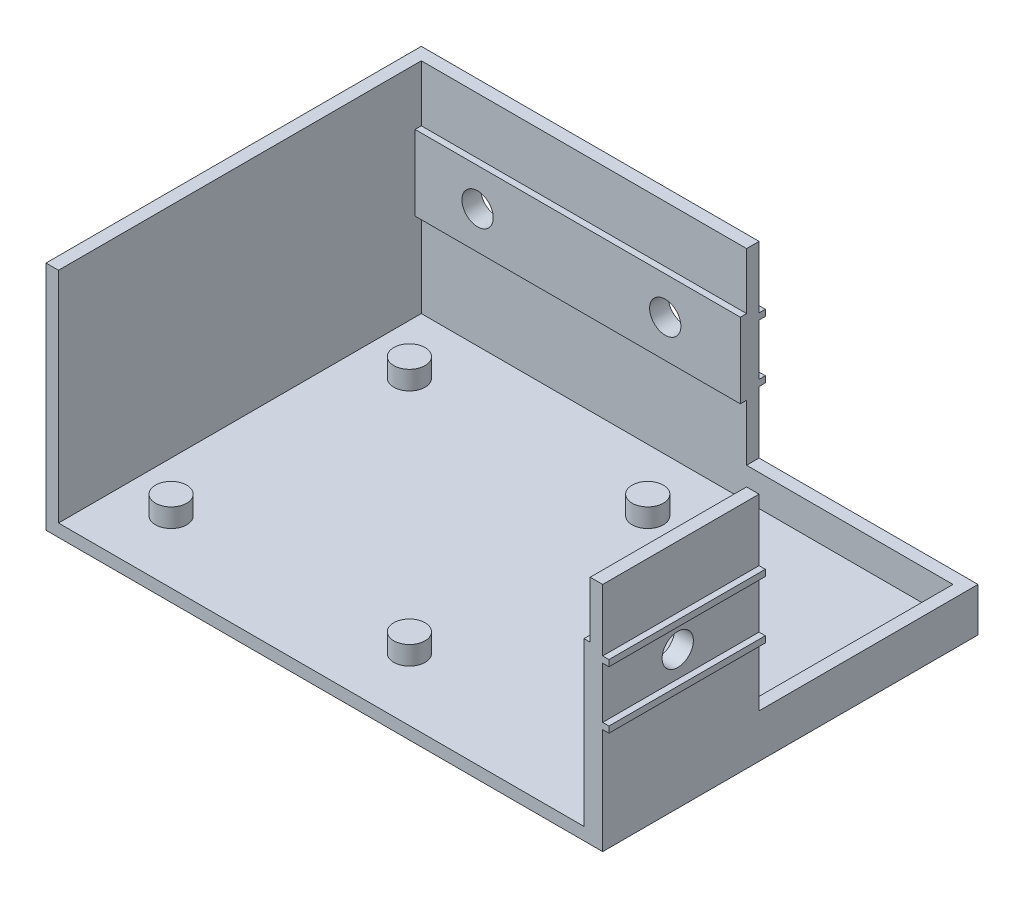
from build123d import *

# Parameters (mm, degrees)
SKETCH_382_W           = 89
SKETCH_382_H           = 60
EXTRUDE_435_DEPTH      = 2
SKETCH_485_R           = 2.5
EXTRUDE_742_DEPTH      = 3
EXTRUDE_971_DEPTH      = 35
SKETCH_4_W             = 35
SKETCH_4_H             = 35
CUT_EXTRUDE_1209_DEPTH = 30
SKETCH_8_W             = 25
SKETCH_8_H             = 26
EXTRUDE_1460_DEPTH     = 1
SKETCH_10_R            = 2.5
CUT_EXTRUDE_1690_DEPTH = 112.198021565
SKETCH_11_W            = 25
SKETCH_11_H            = 1
EXTRUDE_2041_DEPTH     = 1
SKETCH_7_W             = 52
SKETCH_7_H             = 12
EXTRUDE_2256_DEPTH     = 1
SKETCH_2308_R          = 2.5
CUT_EXTRUDE_2474_DEPTH = 113.774110504
SKETCH_12_W            = 54
SKETCH_12_H            = 1
EXTRUDE_2720_DEPTH     = 1


with BuildPart() as part:
    # Sketch 382 → Extrude 435 (new body)
    with BuildSketch(Plane(origin=(0, 0, 0), x_dir=(1, 0, 0), z_dir=(0, 1, 0))):
        with Locations((44.5, 30)):
            Rectangle(SKETCH_382_W, SKETCH_382_H)
    extrude(amount=EXTRUDE_435_DEPTH)

    # Sketch 485 → Extrude 742 (add)
    with BuildSketch(Plane(origin=(0, 2, 0), x_dir=(1, 0, 0), z_dir=(0, 1, 0))):
        with Locations((10, 10)):
            Circle(SKETCH_485_R)
        with Locations((48.1, 10)):
            Circle(SKETCH_485_R)
        with Locations((48.1, 48.1)):
            Circle(SKETCH_485_R)
        with Locations((10, 48.1)):
            Circle(SKETCH_485_R)
    extrude(amount=EXTRUDE_742_DEPTH)

    # Sketch 787 → Extrude 971 (add)
    with BuildSketch(Plane(origin=(0, 2, 0), x_dir=(1, 0, 0), z_dir=(0, 1, 0))):
        Polygon((87, 0), (87, 58), (2, 58), (2, 0), (0, 0), (0, 60), (89, 60), (89, 0), align=None)
    extrude(amount=EXTRUDE_971_DEPTH)

    # 草图4 → Cut-Extrude 1209 (cut)
    with BuildSketch(Plane(origin=(0, 37, 0), x_dir=(1, 0, 0), z_dir=(0, 1, 0))):
        with Locations((71.5, 42.5)):
            Rectangle(SKETCH_4_W, SKETCH_4_H)
    extrude(amount=-CUT_EXTRUDE_1209_DEPTH, mode=Mode.SUBTRACT)

    # 草图8 → Extrude 1460 (add)
    with BuildSketch(Plane.ZY.offset(-87)):
        with Locations((-12.5, 15)):
            Rectangle(SKETCH_8_W, SKETCH_8_H)
    extrude(amount=EXTRUDE_1460_DEPTH)

    # 草图10 → Cut-Extrude 1690 (cut, through all)
    with BuildSketch(Plane.ZY.offset(-86)):
        with Locations((-12, 22)):
            Circle(SKETCH_10_R)
    extrude(amount=-CUT_EXTRUDE_1690_DEPTH, mode=Mode.SUBTRACT)

    # 草图11 → Extrude 2041 (add)
    with BuildSketch(Plane(origin=(89, 0, 0), x_dir=(0, 0, -1), z_dir=(1, 0, 0))):
        with Locations((12.5, 26.6)):
            Rectangle(SKETCH_11_W, SKETCH_11_H)
        with Locations((12.5, 17.4)):
            Rectangle(SKETCH_11_W, SKETCH_11_H)
    extrude(amount=EXTRUDE_2041_DEPTH)

    # 草图7 → Extrude 2256 (add)
    with BuildSketch(Plane.XY.offset(-58)):
        with Locations((28, 22)):
            Rectangle(SKETCH_7_W, SKETCH_7_H)
    extrude(amount=EXTRUDE_2256_DEPTH)

    # Sketch 2308 → Cut-Extrude 2474 (cut, through all)
    with BuildSketch(Plane.XY.offset(-57)):
        with Locations((12, 22)):
            Circle(SKETCH_2308_R)
        with Locations((42, 22)):
            Circle(SKETCH_2308_R)
    extrude(amount=-CUT_EXTRUDE_2474_DEPTH, mode=Mode.SUBTRACT)

    # 草图12 → Extrude 2720 (add)
    with BuildSketch(Plane(origin=(0, 0, -60), x_dir=(-1, 0, 0), z_dir=(0, 0, -1))):
        with Locations((-27, 26.6)):
            Rectangle(SKETCH_12_W, SKETCH_12_H)
        with Locations((-27, 17.4)):
            Rectangle(SKETCH_12_W, SKETCH_12_H)
    extrude(amount=EXTRUDE_2720_DEPTH)


solid = part.part
